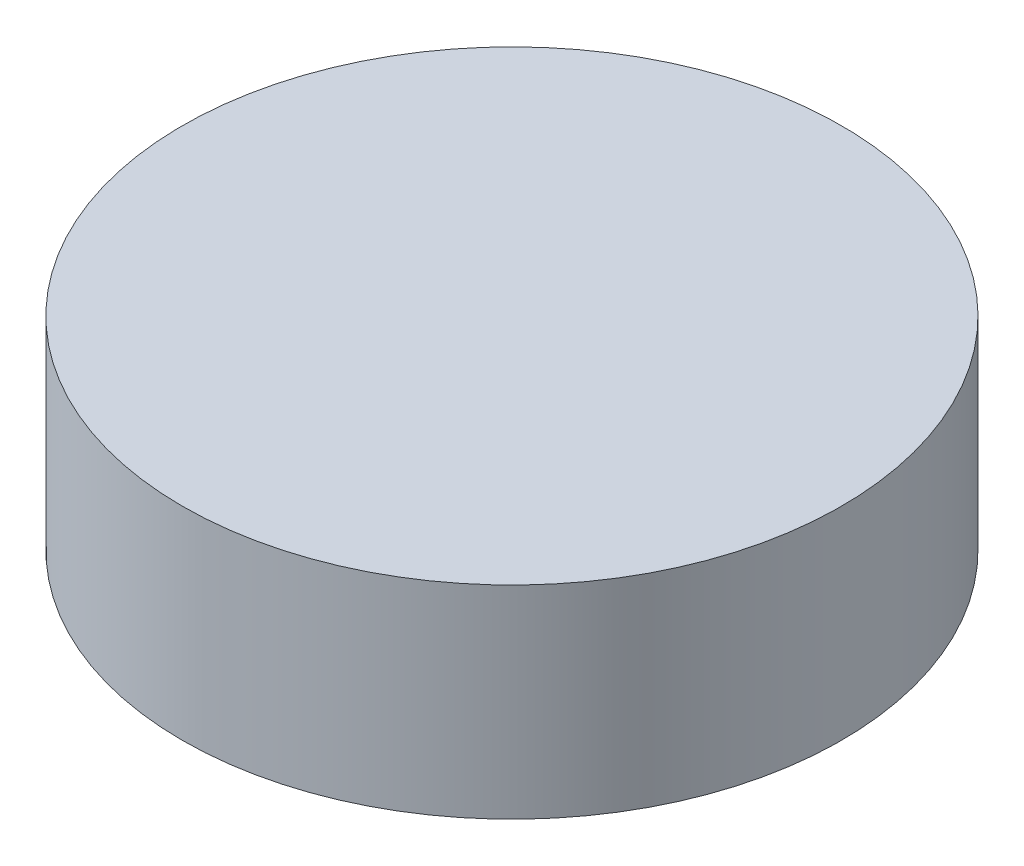
from build123d import *

# Parameters (mm, degrees)
SKETCH1_R           = 32.5
BOSS_EXTRUDE1_DEPTH = 10
SKETCH2_R           = 21.5
CUT_EXTRUDE1_DEPTH  = 15


with BuildPart() as part:
    # Sketch1 → Boss-Extrude1 (new, symmetric)
    with BuildSketch(Plane(origin=(0, 0, 0), x_dir=(1, 0, 0), z_dir=(0, 1, 0))):
        Circle(SKETCH1_R)
    extrude(amount=BOSS_EXTRUDE1_DEPTH, both=True)

    # Sketch2 → Cut-Extrude1 (cut)
    with BuildSketch(Plane.XZ.offset(10)):
        Circle(SKETCH2_R)
    extrude(amount=-CUT_EXTRUDE1_DEPTH, mode=Mode.SUBTRACT)


solid = part.part
